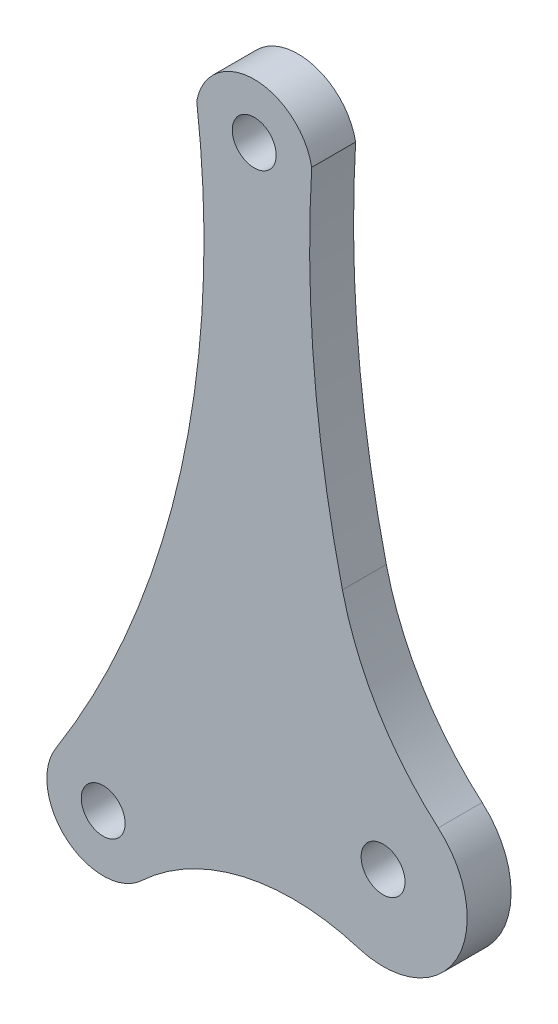
from build123d import *

# Parameters (mm, degrees)
ESQUISSE1_R               = 1.5
T_LE_DE_BASE_PLI_E1_DEPTH = 3


# Sheet-metal steps are written as plain solids
with BuildPart() as part:
    # Esquisse1 → Tôle de base pliée1 (new body)
    with BuildSketch(Plane.XY):
        with BuildLine():
            ThreePointArc((1266.925045451, 1453.637099805), (1270.853858472, 1456.885815408), (1274.782671493, 1453.637099805))
            ThreePointArc((1274.782671493, 1453.637099805), (1274.958888422, 1441.583989625), (1276.882340742, 1429.684038004))
            ThreePointArc((1276.882340742, 1429.684038004), (1279.307388945, 1423.763410381), (1283.429682965, 1418.870417202))
            ThreePointArc((1283.429682965, 1418.870417202), (1284.686333081, 1411.736203474), (1277.965134068, 1409.03404529))
            ThreePointArc((1277.965134068, 1409.03404529), (1270.106079959, 1409.318689972), (1263.166360558, 1405.619223969))
            ThreePointArc((1263.166360558, 1405.619223969), (1258.081900759, 1405.461151241), (1257.278806491, 1410.484273581))
            ThreePointArc((1257.278806491, 1410.484273581), (1265.841325108, 1431.224793872), (1266.925045451, 1453.637099805))
        make_face()
        with Locations((1279.65990658, 1414.528610435)):
            Circle(ESQUISSE1_R, mode=Mode.SUBTRACT)
        with Locations((1260.534319165, 1408.429002982)):
            Circle(ESQUISSE1_R, mode=Mode.SUBTRACT)
        with Locations((1270.855299475, 1453.137882296)):
            Circle(ESQUISSE1_R, mode=Mode.SUBTRACT)
    extrude(amount=-T_LE_DE_BASE_PLI_E1_DEPTH)


solid = part.part
